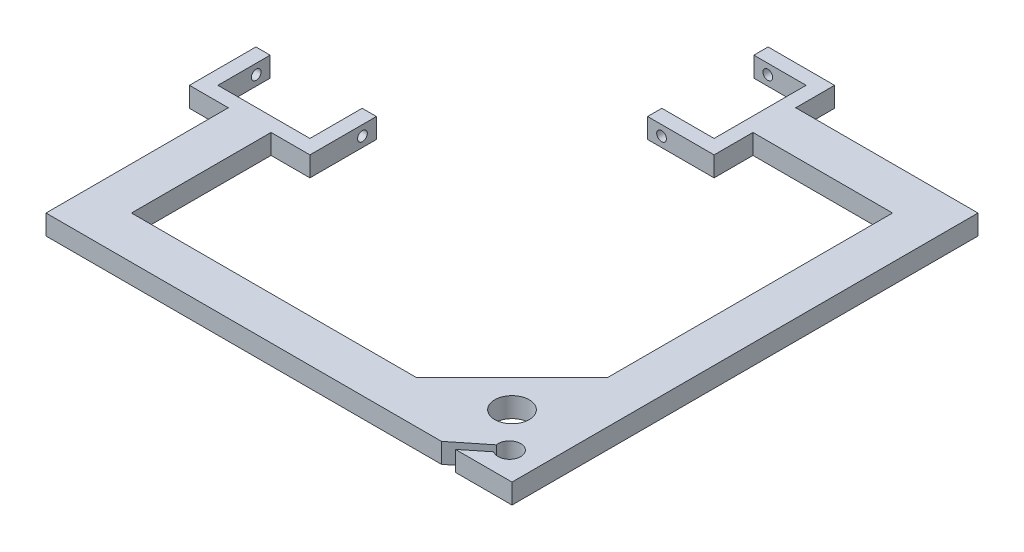
from build123d import *

# Parameters (mm, degrees)
SKETCH1_R           = 6.05
BOSS_EXTRUDE1_DEPTH = 7
SKETCH2_R           = 1.7
CUT_EXTRUDE1_DEPTH  = 50
SKETCH3_R           = 1.7
CUT_EXTRUDE2_DEPTH  = 50


with BuildPart() as part:
    # Sketch1 → Boss-Extrude1 (new body)
    with BuildSketch(Plane(origin=(0, 0, 0), x_dir=(1, 0, 0), z_dir=(0, 1, 0))):
        with BuildLine():
            Line((-84.9, -24.655178012), (-84.9, -42.995178012))
            Line((-84.9, -42.995178012), (-52.6, -42.995178012))
            Line((-52.6, -42.995178012), (-52.6, -24.655178012))
            Line((-52.6, -24.655178012), (-47.6, -24.655178012))
            Line((-47.6, -24.655178012), (-47.6, -47.995178012))
            Line((-47.6, -47.995178012), (-61.25, -47.995178012))
            Line((-61.25, -47.995178012), (-61.25, -96.995178012))
            Line((-61.25, -96.995178012), (38.75, -96.995178012))
            Line((38.75, -96.995178012), (72.34, -63.405178012))
            Line((72.34, -63.405178012), (72.34, 36.594821988))
            Line((72.34, 36.594821988), (23.34, 36.594821988))
            Line((23.34, 36.594821988), (23.34, 22.944821988))
            Line((23.34, 22.944821988), (0, 22.944821988))
            Line((0, 22.944821988), (0, 27.944821988))
            Line((0, 27.944821988), (18.34, 27.944821988))
            Line((18.34, 27.944821988), (18.34, 60.244821988))
            Line((18.34, 60.244821988), (0, 60.244821988))
            Line((0, 60.244821988), (0, 65.244821988))
            Line((0, 65.244821988), (23.34, 65.244821988))
            Line((23.34, 65.244821988), (23.34, 51.594821988))
            Line((23.34, 51.594821988), (87.34, 51.594821988))
            Line((87.34, 51.594821988), (87.34, -63.405178012))
            Line((87.34, -63.405178012), (87.34, -111.995178012))
            Line((87.34, -111.995178012), (67.474963518, -111.995178012))
            Line((67.474963518, -111.995178012), (74.946063238, -106.013510987))
            ThreePointArc((74.946063238, -106.013510987), (80.494481987, -100.561578198), (73.265531111, -103.433997211))
            Line((73.265531111, -103.433997211), (62.572619718, -111.995178012))
            Line((62.572619718, -111.995178012), (38.75, -111.995178012))
            Line((38.75, -111.995178012), (-76.25, -111.995178012))
            Line((-76.25, -111.995178012), (-76.25, -47.995178012))
            Line((-76.25, -47.995178012), (-89.9, -47.995178012))
            Line((-89.9, -47.995178012), (-89.9, -24.655178012))
            Line((-89.9, -24.655178012), (-84.9, -24.655178012))
        make_face()
        with Locations((65.34, -89.995178012)):
            Circle(SKETCH1_R, mode=Mode.SUBTRACT)
    extrude(amount=BOSS_EXTRUDE1_DEPTH)

    # Sketch2 → Cut-Extrude1 (cut)
    with BuildSketch(Plane.XY.offset(-22.944821988)):
        with Locations((4.9, 3.5)):
            Circle(SKETCH2_R)
    extrude(amount=-CUT_EXTRUDE1_DEPTH, mode=Mode.SUBTRACT)

    # Sketch3 → Cut-Extrude2 (cut)
    with BuildSketch(Plane(origin=(-47.6, 0, 0), x_dir=(0, 0, -1), z_dir=(1, 0, 0))):
        with Locations((-29.555178012, 3.5)):
            Circle(SKETCH3_R)
    extrude(amount=-CUT_EXTRUDE2_DEPTH, mode=Mode.SUBTRACT)


solid = part.part
